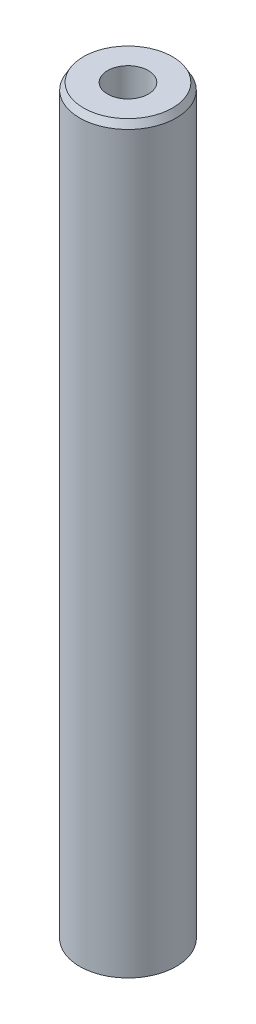
from build123d import *
from OCP.BRepFilletAPI import BRepFilletAPI_MakeChamfer

# Parameters (mm, degrees)
SKETCH1_R           = 7.5
BOSS_EXTRUDE1_DEPTH = 115.641286848
SKETCH2_R           = 3.165915755
CUT_EXTRUDE1_DEPTH  = 117.126686097
CHAMFER1_SIZE       = 1.035751797
CHAMFER1_SIZE2      = 0.597991579


with BuildPart() as part:
    # Sketch1 → Boss-Extrude1 (new body)
    with BuildSketch(Plane(origin=(0, 0, 0), x_dir=(1, 0, 0), z_dir=(0, 1, 0))):
        Circle(SKETCH1_R)
    extrude(amount=BOSS_EXTRUDE1_DEPTH)

    # Sketch2 → Cut-Extrude1 (cut, through all)
    with BuildSketch(Plane(origin=(0, 0, 0), x_dir=(1, 0, 0), z_dir=(0, 1, 0))):
        Circle(SKETCH2_R)
    extrude(amount=CUT_EXTRUDE1_DEPTH, mode=Mode.SUBTRACT)

    # Chamfer1: one chamfer whose edges measure the first distance from different faces: ONE call of the kernel's chamfer builder (chamfer() names one face for all edges)
    chamfer1_edges_1 = [part.edges().sort_by_distance(p)[0] for p in [
        (-7.5, 115.641286848, 0),
    ]]
    chamfer1_side_1 = [part.faces().sort_by_distance(p)[0] for p in [
        (-7.5, 57.820643424, 0),
    ]]
    chamfer1_edges_2 = [part.edges().sort_by_distance(p)[0] for p in [
        (-7.5, 0, 0),
    ]]
    chamfer1_side_2 = [part.faces().sort_by_distance(p)[0] for p in [
        (-7.287867966, 0, 0),
    ]]
    chamfer1 = BRepFilletAPI_MakeChamfer(part.part.solid().wrapped)
    for e in chamfer1_edges_1:
        chamfer1.Add(CHAMFER1_SIZE, CHAMFER1_SIZE2, e.wrapped, chamfer1_side_1[0].wrapped)  # the first distance lies on this face
    for e in chamfer1_edges_2:
        chamfer1.Add(CHAMFER1_SIZE, CHAMFER1_SIZE2, e.wrapped, chamfer1_side_2[0].wrapped)  # the first distance lies on this face
    add(Compound.cast(chamfer1.Shape()), mode=Mode.REPLACE)


solid = part.part
